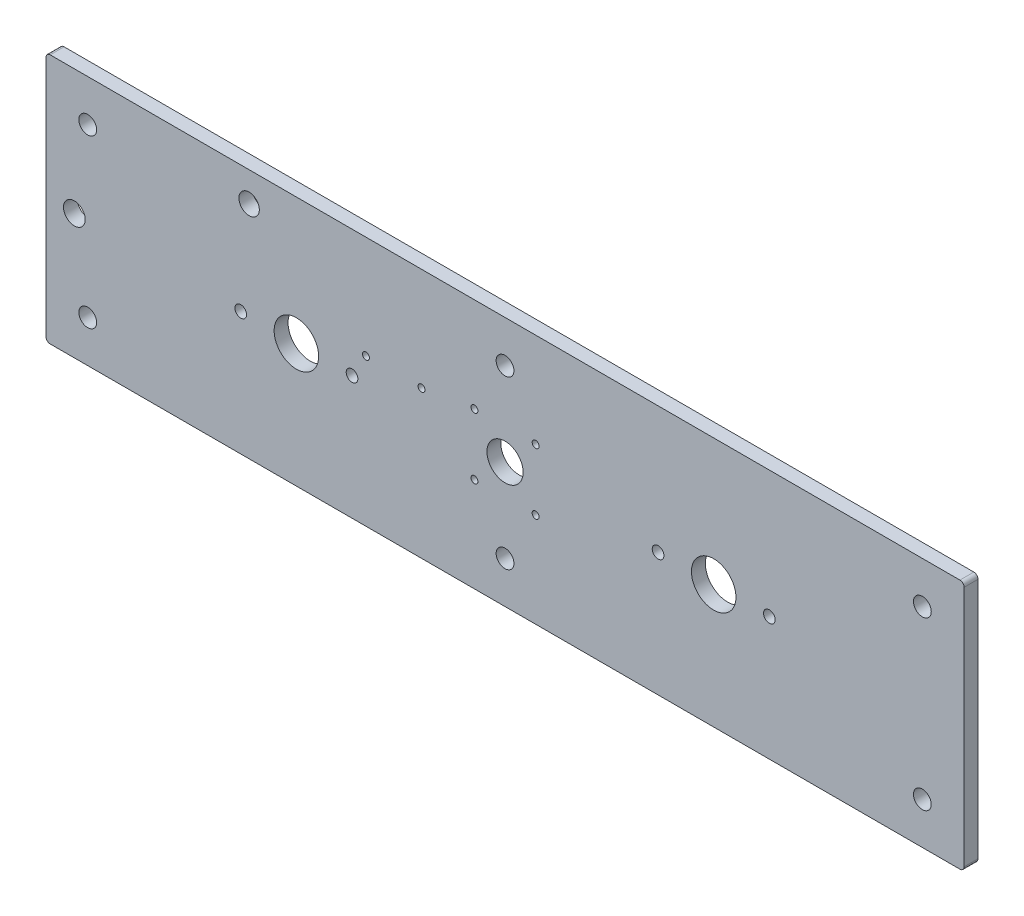
from build123d import *

# Parameters (mm, degrees)
SKETCH1_W                = 330
SKETCH1_H                = 90
BOSS_EXTRUDE1_DEPTH      = 2.5
M6_CLEARANCE_HOLE1_D     = 6.4
M6_CLEARANCE_HOLE1_DEPTH = 10
M6_CLEARANCE_HOLE1_TIP   = 1.922753981
SKETCH3_R                = 8
CUT_EXTRUDE2_DEPTH       = 172.099386323
M5X0_8_TAPPED_HOLE1_D    = 4.2
SKETCH4_R                = 6.5
CUT_EXTRUDE3_DEPTH       = 172.099386323
M3X0_5_TAPPED_HOLE1_D    = 2.5
FILLET1_R                = 1.5
M3X0_5_TAPPED_HOLE2_D    = 2.5
SKETCH13_R               = 3.671147944
CUT_EXTRUDE4_DEPTH       = 172.099386323
SKETCH14_R               = 3.907179027
CUT_EXTRUDE5_DEPTH       = 10


with BuildPart() as part:
    # Sketch1 → Boss-Extrude1 (new, symmetric)
    with BuildSketch(Plane.XY):
        Rectangle(SKETCH1_W, SKETCH1_H)
    extrude(amount=BOSS_EXTRUDE1_DEPTH, both=True)

    # M6 Clearance Hole1
    with Locations(Plane.XY.offset(2.5)):
        with Locations((-150, 30), (-150, -30), (0, 30), (0, -30), (150, -30), (150, 30)):
            Hole(M6_CLEARANCE_HOLE1_D / 2, depth=M6_CLEARANCE_HOLE1_DEPTH)
            with Locations((0, 0, -(M6_CLEARANCE_HOLE1_DEPTH + M6_CLEARANCE_HOLE1_TIP / 2))):  # 118° drill point
                Cone(0, M6_CLEARANCE_HOLE1_D / 2, M6_CLEARANCE_HOLE1_TIP, mode=Mode.SUBTRACT)

    # Sketch3 → Cut-Extrude2 (cut, through all)
    with BuildSketch(Plane.XY.offset(2.5)):
        with Locations((-75, -0.6)):
            Circle(SKETCH3_R)
    cut_extrude2 = extrude(amount=-CUT_EXTRUDE2_DEPTH, mode=Mode.SUBTRACT)

    # M5x0.8 Tapped Hole1 (through all)
    with Locations(Plane.XY.offset(2.5)):
        with Locations((-95, -0.6), (-55, -0.6)):
            m5x0_8_tapped_hole1 = Hole(M5X0_8_TAPPED_HOLE1_D / 2)

    # Mirror1: Cut-Extrude2, M5x0.8 Tapped Hole1 across plane
    add(cut_extrude2.mirror(Plane(origin=(0, 0, 0), x_dir=(0, 0, 1), z_dir=(1, 0, 0))), mode=Mode.SUBTRACT)
    add(m5x0_8_tapped_hole1.mirror(Plane(origin=(0, 0, 0), x_dir=(0, 0, 1), z_dir=(1, 0, 0))), mode=Mode.SUBTRACT)

    # Sketch4 → Cut-Extrude3 (cut, through all)
    with BuildSketch(Plane.XY.offset(2.5)):
        Circle(SKETCH4_R)
    extrude(amount=-CUT_EXTRUDE3_DEPTH, mode=Mode.SUBTRACT)

    # M3x0.5 Tapped Hole1 (through all)
    with Locations(Plane.XY.offset(2.5)):
        with Locations((11, 11), (-11, -11), (-11, 11), (11, -11)):
            Hole(M3X0_5_TAPPED_HOLE1_D / 2)

    # Fillet1
    fillet1_edges = [part.edges().sort_by_distance(p)[0] for p in [
        (-165, -45, 0),
        (-165, 45, 0),
        (165, -45, 0),
        (165, 45, 0),
    ]]
    fillet(fillet1_edges, radius=FILLET1_R)

    # M3x0.5 Tapped Hole2 (through all)
    with Locations(Plane.XY.offset(2.5)):
        with Locations((-30, 8), (-50, 8)):
            Hole(M3X0_5_TAPPED_HOLE2_D / 2)

    # Sketch13 → Cut-Extrude4 (cut, through all)
    with BuildSketch(Plane.XY.offset(2.5)):
        with Locations((-91.9931433, 34.355887575)):
            Circle(SKETCH13_R)
    extrude(amount=-CUT_EXTRUDE4_DEPTH, mode=Mode.SUBTRACT)

    # Sketch14 → Cut-Extrude5 (cut)
    with BuildSketch(Plane.XY.offset(2.5)):
        with Locations((-154.805971452, 0)):
            Circle(SKETCH14_R)
    extrude(amount=-CUT_EXTRUDE5_DEPTH, mode=Mode.SUBTRACT)


solid = part.part
